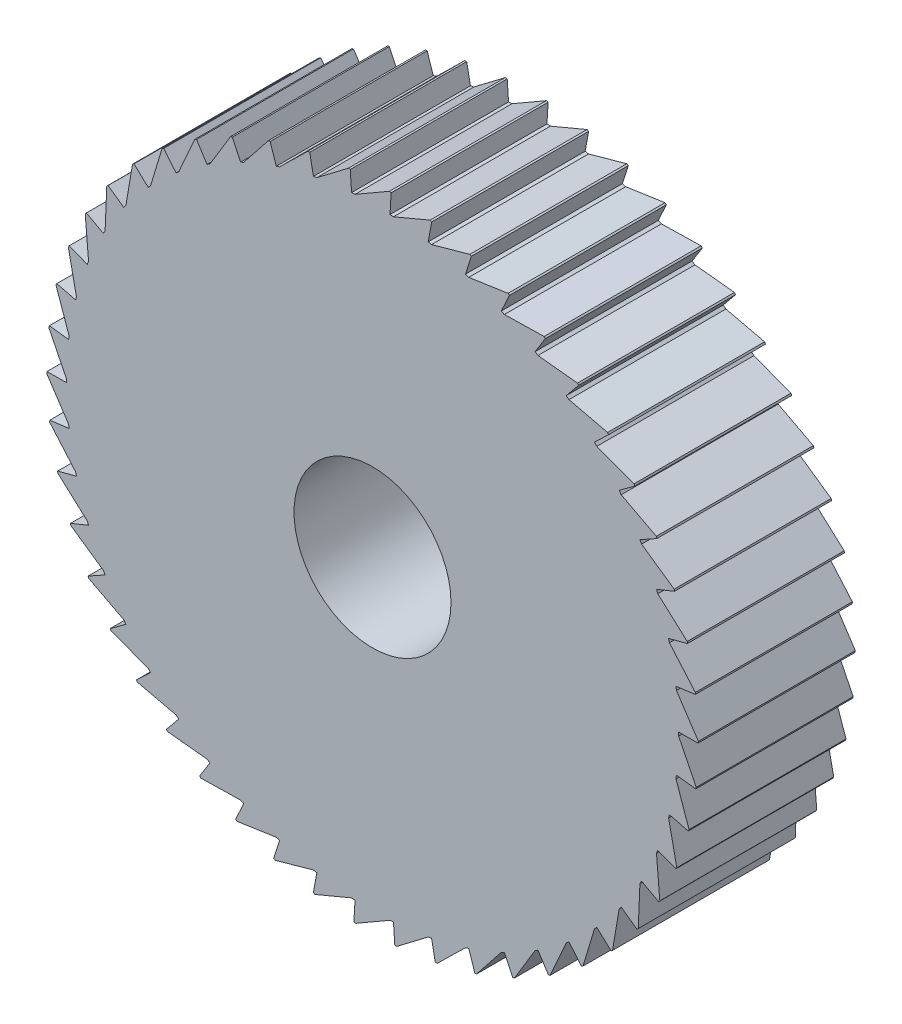
from build123d import *

# Parameters (mm, degrees)
SKETCH1_R                     = 23.4
SKETCH1_R_2                   = 6
BOSS_EXTRUDE1_DEPTH           = 12
BOSS_EXTRUDE2_DEPTH           = 12
CHAMFER2_SIZE                 = 0.16
CHAMFER2_SIZE2                = 0.115547223
CIRPATTERN1_COUNT             = 50
CHAMFER2_OF_CIRPATTERN1_SIZE2 = 0.16
CHAMFER2_OF_CIRPATTERN1_SIZE  = 0.115547223


with BuildPart() as part:
    # Sketch1 → Boss-Extrude1 (new body)
    with BuildSketch(Plane.XY):
        Circle(SKETCH1_R)
        Circle(SKETCH1_R_2, mode=Mode.SUBTRACT)
    extrude(amount=-BOSS_EXTRUDE1_DEPTH)

    # Sketch2 → Boss-Extrude2 (add)
    with BuildSketch(Plane.XY):
        with BuildLine():
            Line((-1.33764343, 23.361736024), (1.429106228, 24.959119684))
            Line((1.429106228, 24.959119684), (1.33764343, 23.361736024))
            ThreePointArc((1.33764343, 23.361736024), (0, 23.4), (-1.33764343, 23.361736024))
        make_face()
    boss_extrude2 = extrude(amount=-BOSS_EXTRUDE2_DEPTH)

    # Chamfer2
    chamfer2_edges = [part.edges().sort_by_distance(p)[0] for p in [
        (1.429106228, 24.959119684, -6),
    ]]
    chamfer2_side = [part.faces().sort_by_distance(p)[0] for p in [
        (0.045731399, 24.160427854, -6),
    ]]
    chamfer(chamfer2_edges, length=CHAMFER2_SIZE, length2=CHAMFER2_SIZE2, reference=chamfer2_side[0])

    # CirPattern1: Boss-Extrude2 ×50 about axis
    cirpattern1_axis = Axis((0, 0, 0), (0, 0, 1))
    for i in range(1, CIRPATTERN1_COUNT):
        add(boss_extrude2.rotate(cirpattern1_axis, i * 360 / CIRPATTERN1_COUNT))

    # Chamfer2 of CirPattern1
    chamfer2_of_cirpattern1_edges = [part.edges().sort_by_distance(p)[0] for p in [
        (-1.710369878, 24.941424075, -6),
        (-4.82287243, 24.530387309, -6),
        (-7.859315402, 23.732491681, -6),
        (-10.771812276, 22.560320483, -6),
        (-13.514431235, 21.032359554, -6),
        (-16.04391954, 19.17270575, -6),
        (-18.320385651, 17.010686924, -6),
        (-20.307928335, 14.580399403, -6),
        (-21.975202858, 11.920170273, -6),
        (-23.295915305, 9.071952938, -6),
        (-24.249237251, 6.080665485, -6),
        (-24.82013424, 2.993482305, -6),
        (-24.999602885, -0.140909878, -6),
        (-24.784812859, -3.273079829, -6),
        (-24.179151528, -6.353631356, -6),
        (-23.192170533, -9.333982321, -6),
        (-21.839435155, -12.167130809, -6),
        (-20.142278838, -14.808396375, -6),
        (-18.127466752, -17.216124685, -6),
        (-15.826773686, -19.352344424, -6),
        (-13.276482944, -21.183366131, -6),
        (-10.516814136, -22.680313499, -6),
        (-7.591288886, -23.819578776, -6),
        (-4.546044476, -24.583195065, -6),
        (-1.429106228, -24.959119684, -6),
        (1.710369878, -24.941424075, -6),
        (4.82287243, -24.530387309, -6),
        (7.859315402, -23.732491681, -6),
        (10.771812276, -22.560320483, -6),
        (13.514431235, -21.032359554, -6),
        (16.04391954, -19.17270575, -6),
        (18.320385651, -17.010686924, -6),
        (20.307928335, -14.580399403, -6),
        (21.975202858, -11.920170273, -6),
        (23.295915305, -9.071952938, -6),
        (24.249237251, -6.080665485, -6),
        (24.82013424, -2.993482305, -6),
        (24.999602885, 0.140909878, -6),
        (24.784812859, 3.273079829, -6),
        (24.179151528, 6.353631356, -6),
        (23.192170533, 9.333982321, -6),
        (21.839435155, 12.167130809, -6),
        (20.142278838, 14.808396375, -6),
        (18.127466752, 17.216124685, -6),
        (15.826773686, 19.352344424, -6),
        (13.276482944, 21.183366131, -6),
        (10.516814136, 22.680313499, -6),
        (7.591288886, 23.819578776, -6),
        (4.546044476, 24.583195065, -6),
    ]]
    chamfer(chamfer2_of_cirpattern1_edges, length=CHAMFER2_OF_CIRPATTERN1_SIZE, length2=CHAMFER2_OF_CIRPATTERN1_SIZE2)


solid = part.part
